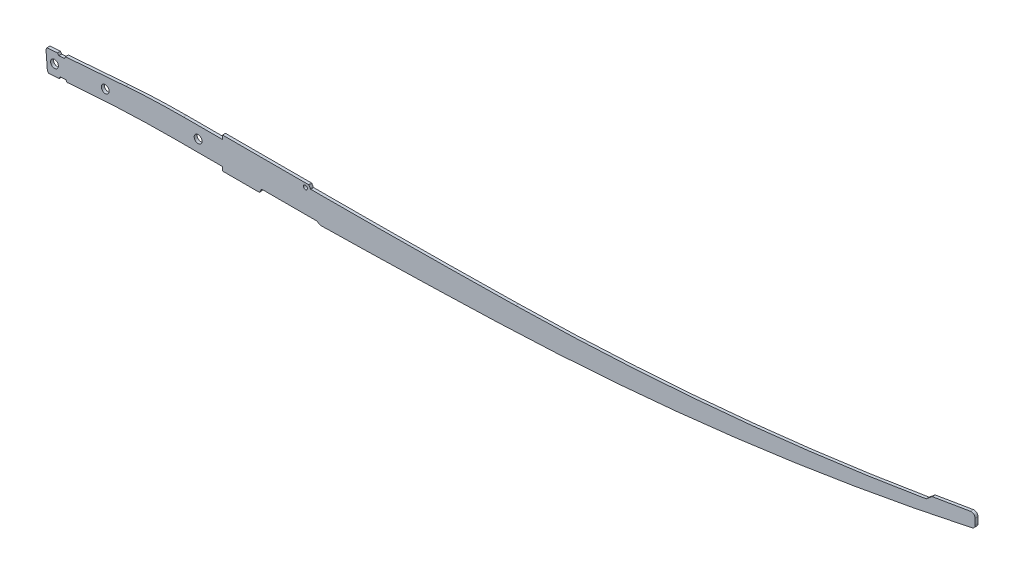
from build123d import *

# Parameters (mm, degrees)
SKETCH_1_R      = 2.01
SKETCH_1_R_2    = 4.01
EXTRUDE_1_DEPTH = 1.5
FILLET_1_R      = 4
FILLET_2_R      = 0.5


with BuildPart() as part:
    # 草图1 → 凸台-拉伸1 (new, symmetric)
    with BuildSketch(Plane.XY):
        with BuildLine():
            Line((88.267949192, 16), (0, 16))
            Line((0, 16), (0, 12))
            Line((0, 12), (-40, 12))
            ThreePointArc((-40, 12), (-69.535854335, 11.432212704), (-99.028064993, 9.729689808))
            Line((-99.028064993, 9.729689808), (-160.844903988, 4.967503693))
            Line((-160.844903988, 4.967503693), (-161.842574392, 2.884720195))
            Line((-161.842574392, 2.884720195), (-167.516362092, 2.447628402))
            Line((-167.516362092, 2.447628402), (-168.82127031, 4.353028065))
            Line((-168.82127031, 4.353028065), (-179.634530482, 3.520006541))
            Line((-179.634530482, 3.520006541), (-180.632200886, 1.437223043))
            Line((-180.632200886, 1.437223043), (-179.249630724, -16.509601182))
            Line((-179.249630724, -16.509601182), (-177.944722506, -18.415000845))
            Line((-177.944722506, -18.415000845), (-167.131462334, -17.581979321))
            Line((-167.131462334, -17.581979321), (-166.13379193, -15.499195823))
            Line((-166.13379193, -15.499195823), (-160.46000423, -15.06210403))
            Line((-160.46000423, -15.06210403), (-159.155096012, -16.967503693))
            Line((-159.155096012, -16.967503693), (-140, -15.491851852))
            ThreePointArc((-140, -15.491851852), (-94.639489017, -12.873285566), (-49.211851852, -12))
            Line((-49.211851852, -12), (0, -12))
            Line((0, -12), (0, -16))
            Line((0, -16), (37.690598923, -16))
            Line((37.690598923, -16), (40, -12))
            Line((40, -12), (96.535898385, -12))
            Line((96.535898385, -12), (100, -14))
            ThreePointArc((100, -14), (190.010536768, -12.064480168), (280, -9.318670026))
            ThreePointArc((280, -9.318670026), (526.372741898, 10.371028341), (770, 52))
            Line((770, 52), (770, 66))
            Line((770, 66), (726.083917261, 58.617931631))
            Line((726.083917261, 58.617931631), (720, 53.595256329))
            ThreePointArc((720, 53.595256329), (510.722374485, 26.388379667), (300, 14.837640705))
            ThreePointArc((300, 14.837640705), (195.00402007, 13.459418971), (90, 13))
            Line((90, 13), (88.267949192, 16))
        make_face()
        with Locations((84.8, 12)):
            Circle(SKETCH_1_R, mode=Mode.SUBTRACT)
        with Locations((-171.964549483, -6.921713442)):
            Circle(SKETCH_1_R_2, mode=Mode.SUBTRACT)
        with Locations((-120, -3.315359825)):
            Circle(SKETCH_1_R_2, mode=Mode.SUBTRACT)
        with Locations((-25, -0.10857011)):
            Circle(SKETCH_1_R_2, mode=Mode.SUBTRACT)
    extrude(amount=EXTRUDE_1_DEPTH, both=True)

    # 圆角1
    fillet_1_edges = [part.edges().sort_by_distance(p)[0] for p in [
        (770, 66, 0),
        (770, 52, 0),
    ]]
    fillet(fillet_1_edges, radius=FILLET_1_R)

    # 圆角2
    fillet_2_edges = [part.edges().sort_by_distance(p)[0] for p in [
        (720, 53.595256329, 0),
        (726.083917261, 58.617931631, 0),
        (40, -12, 0),
        (96.535898385, -12, 0),
        (100, -14, 0),
        (90, 13, 0),
        (88.267949192, 16, 0),
        (37.690598923, -16, 0),
    ]]
    fillet(fillet_2_edges, radius=FILLET_2_R)


solid = part.part
